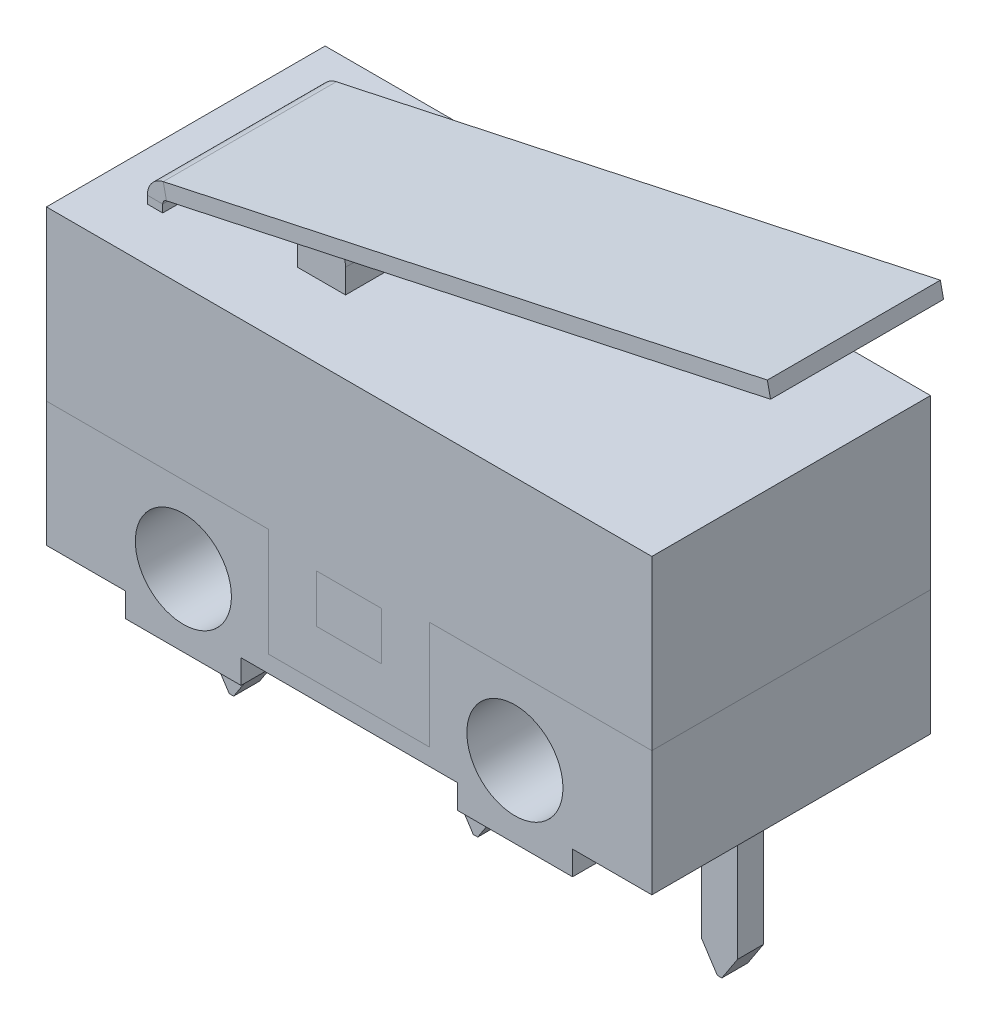
from build123d import *

# Parameters (mm, degrees)
SKETCH2_R           = 1
BODY_DEPTH          = 2.9
LEVER_DEPTH         = 1.8
LEGS_DEPTH          = 0.27
BOSS_EXTRUDE3_DEPTH = 1.375


# Sheet-metal steps are written as plain solids
with BuildPart() as part:
    # Sketch2 → Body (new, symmetric)
    with BuildSketch(Plane.XY):
        Polygon((-6.3, -3.05), (-4.65, -3.05), (-4.65, -3.55), (-2.25, -3.55), (-2.25, -3.05), (2.25, -3.05), (2.25, -3.55), (4.65, -3.55), (4.65, -3.05), (6.3, -3.05), (6.3, 3.05), (-6.3, 3.05), align=None)
        with Locations((-3.45, -2.05)):
            Circle(SKETCH2_R, mode=Mode.SUBTRACT)
        with Locations((3.45, -2.05)):
            Circle(SKETCH2_R, mode=Mode.SUBTRACT)
    extrude(amount=BODY_DEPTH, both=True)

    # Sketch8 → Legs (add, symmetric)
    with BuildSketch(Plane.XY):
        Polygon((-4.705, -3.05), (-5.455, -3.05), (-5.455, -5.94846389), (-5.126348987, -6.45), (-5.033651013, -6.45), (-4.705, -5.94846389), align=None)
        Polygon((0.375, -3.05), (-0.375, -3.05), (-0.375, -5.94846389), (-0.046348987, -6.45), (0.046348987, -6.45), (0.375, -5.94846389), align=None)
        Polygon((5.455, -3.05), (4.705, -3.05), (4.705, -5.94846389), (5.033651013, -6.45), (5.126348987, -6.45), (5.455, -5.94846389), align=None)
    extrude(amount=LEGS_DEPTH, both=True)



with BuildPart() as body_2:
    # Sketch3 → Lever (new, symmetric)
    with BuildSketch(Plane.XY):
        with BuildLine():
            Line((-5.3, 3.05), (-5.3, 3.210873935))
            ThreePointArc((-5.3, 3.210873935), (-5.206775112, 3.474726216), (-4.96848559, 3.621447071))
            Line((-4.96848559, 3.621447071), (7.603727147, 6.330975678))
            Line((7.603727147, 6.330975678), (7.671144739, 6.01815805))
            Line((7.671144739, 6.01815805), (-4.901067998, 3.308629443))
            ThreePointArc((-4.901067998, 3.308629443), (-4.957803598, 3.273695906), (-4.98, 3.210873935))
            Line((-4.98, 3.210873935), (-4.98, 3.05))
            Line((-4.98, 3.05), (-5.3, 3.05))
        make_face()
    extrude(amount=LEVER_DEPTH, both=True)


with BuildPart() as part_1:
    add(part.part)

    add(body_2.part)  # Boss-Extrude3 merges body 2
    # Sketch9 → Boss-Extrude3 (add, symmetric)
    with BuildSketch(Plane.XY):
        with BuildLine():
            Line((-2.6, 3.05), (-2.6, 3.55))
            ThreePointArc((-2.6, 3.55), (-2.1, 4.05), (-1.6, 3.55))
            Line((-1.6, 3.55), (-1.6, 3.05))
            Line((-1.6, 3.05), (-2.6, 3.05))
        make_face()
    extrude(amount=BOSS_EXTRUDE3_DEPTH, both=True)


solid = part_1.part
